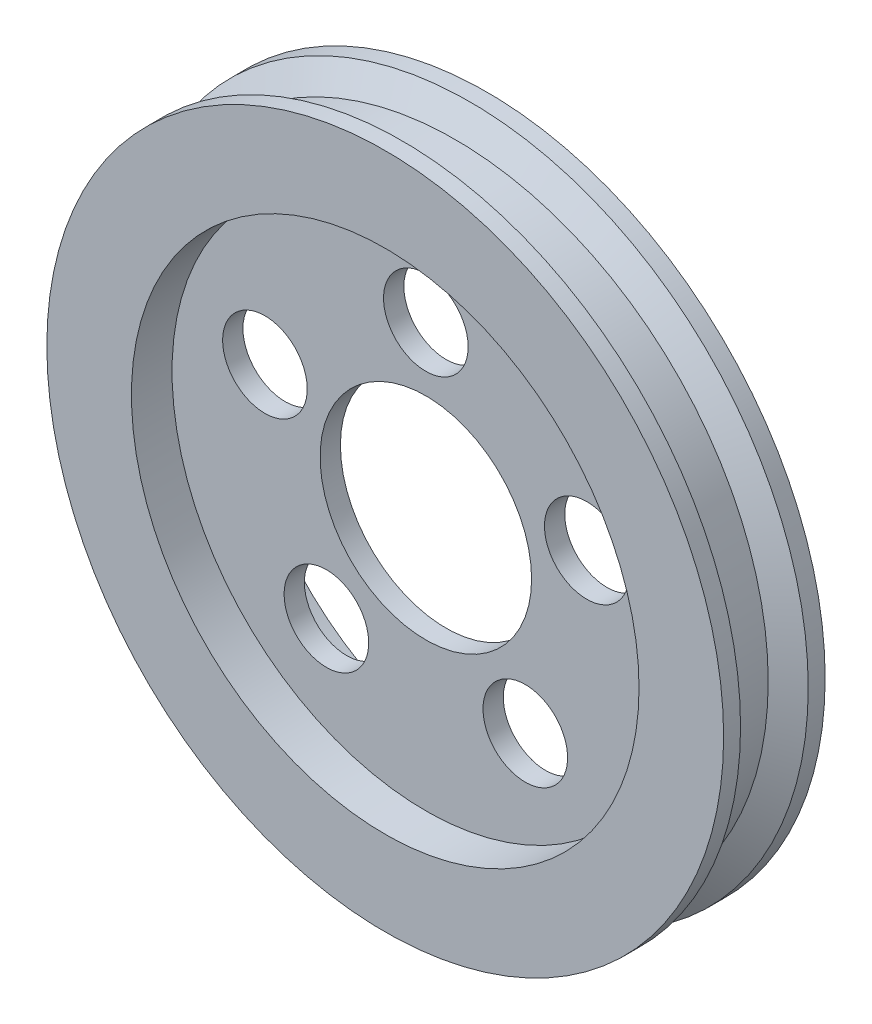
from build123d import *

# Parameters (mm, degrees)
SKETCH1_R                = 20
SKETCH1_R_2              = 4
BOSS_EXTRUDE1_DEPTH      = 3
SKETCH3_R                = 15
CUT_EXTRUDE1_DEPTH       = 2.4
SKETCH4_R                = 2.5
CUT_EXTRUDE2_DEPTH       = 29.51245342
CIRPATTERN1_COUNT        = 5
BOSS_EXTRUDE3_DEPTH      = 1
BOSS_EXTRUDE3_DEPTH_BACK = 2
SKETCH14_R               = 5
SKETCH16_R               = 6.25
CUT_EXTRUDE3_DEPTH       = 29.655889447


with BuildPart() as part:
    # Sketch1 → Boss-Extrude1 (new, symmetric)
    with BuildSketch(Plane.XY):
        Circle(SKETCH1_R)
        Circle(SKETCH1_R_2, mode=Mode.SUBTRACT)
    extrude(amount=BOSS_EXTRUDE1_DEPTH, both=True)

    # Sketch3 → Cut-Extrude1 (cut)
    with BuildSketch(Plane.XY.offset(3)):
        Circle(SKETCH3_R)
    cut_extrude1 = extrude(amount=-CUT_EXTRUDE1_DEPTH, mode=Mode.SUBTRACT)

    # Mirror1: Cut-Extrude1 across plane
    add(cut_extrude1.mirror(Plane.XY), mode=Mode.SUBTRACT)

    # Sketch4 → Cut-Extrude2 (cut, through all)
    with BuildSketch(Plane.XY.offset(0.6)):
        with Locations((0, 10)):
            Circle(SKETCH4_R)
    cut_extrude2 = extrude(amount=-CUT_EXTRUDE2_DEPTH, mode=Mode.SUBTRACT)

    # CirPattern1: Cut-Extrude2 ×5 about axis
    cirpattern1_axis = Axis((0, 0, 3), (0, 0, -1))
    for i in range(1, CIRPATTERN1_COUNT):
        add(cut_extrude2.rotate(cirpattern1_axis, i * 360 / CIRPATTERN1_COUNT), mode=Mode.SUBTRACT)

    # Sketch5 → Cut-Revolve1 (revolve, cut)
    with BuildSketch(Plane(origin=(0, 0, 0), x_dir=(1, 0, 0), z_dir=(0, 1, 0))):
        Polygon((20, 2), (18.5, 1.133974596), (18.5, -1.133974596), (20, -2), align=None)
    revolve(axis=Axis((0, 0, 0), (0, 0, -1)), mode=Mode.SUBTRACT)

    # Sketch14 → Boss-Extrude3 (add, two sides: drawn at the far end of the back side and taken through both)
    with BuildSketch(Plane.XY.offset(0.6).offset(-BOSS_EXTRUDE3_DEPTH_BACK)):
        Circle(SKETCH14_R)
    extrude(amount=BOSS_EXTRUDE3_DEPTH + BOSS_EXTRUDE3_DEPTH_BACK)

    # Sketch16 → Cut-Extrude3 (cut, through all)
    with BuildSketch(Plane.XY.offset(1.6)):
        Circle(SKETCH16_R)
    extrude(amount=-CUT_EXTRUDE3_DEPTH, mode=Mode.SUBTRACT)


solid = part.part
